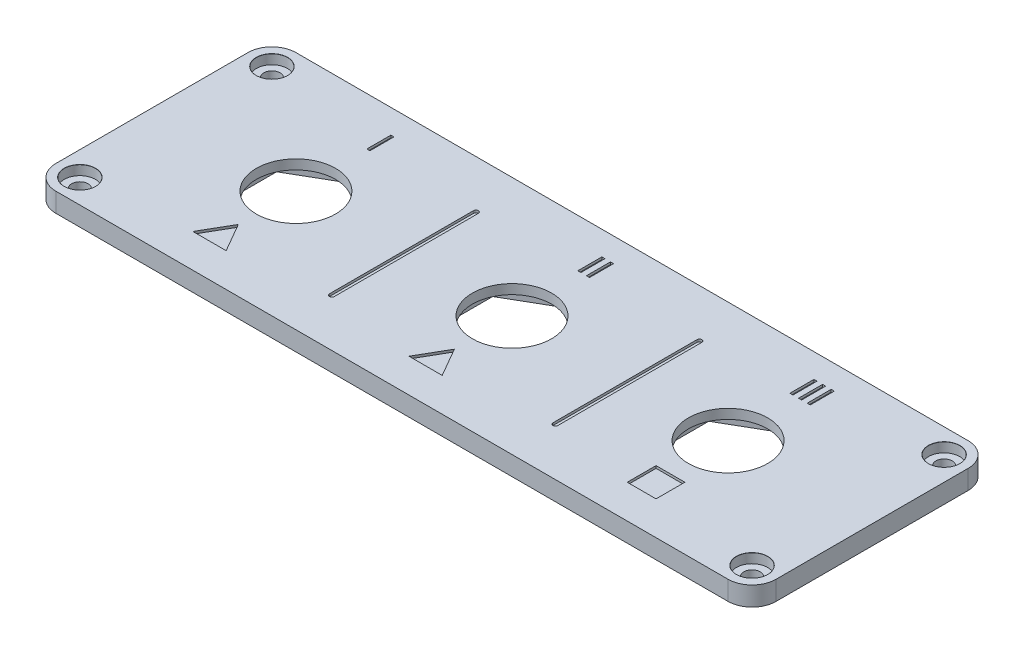
from build123d import *

# Parameters (mm, degrees)
SKETCH1_W                = 150
SKETCH1_H                = 50
BODY_DEPTH               = 4
EDGE_FILLETS_R           = 5
GX16_HOLE_D              = 16.5
GX16_NUT_CUTOUT_DEPTH    = 2
GX16_PATTERN_COUNT       = 3
GX16_PATTERN_PITCH       = 45
DESIGN_CUTOUT_SKETCH_W   = 6
DESIGN_CUTOUT_SKETCH_H   = 6
DESIGN_CUTOUT_SKETCH_W_2 = 0.641025641
DESIGN_CUTOUT_SKETCH_H_2 = 5
DESIGN_CUTOUT_DEPTH      = 0.5


# Read off the part's stored shape, not the designer's step: mounting_holes
with BuildPart() as part:
    # Sketch1 → body (new body)
    with BuildSketch(Plane(origin=(0, 0, 0), x_dir=(1, 0, 0), z_dir=(0, 1, 0))):
        Rectangle(SKETCH1_W, SKETCH1_H)
    extrude(amount=BODY_DEPTH)

    # mounting_holes outline → mounting_holes (revolve, cut)
    with BuildSketch(Plane(origin=(70, 0, 20), x_dir=(1, 0, 0), z_dir=(0, 0, 1))):
        Polygon((0, 0), (1.7, 0), (1.7, 2), (3.25, 2), (3.25, 3.975), (3.275, 4), (0, 4), align=None)
    revolve(axis=Axis((70, 0, 20), (0, 1, 0)), mode=Mode.SUBTRACT)

    # mounting_holes 2 outline → mounting_holes 2 (revolve, cut)
    with BuildSketch(Plane(origin=(-70, 0, -20), x_dir=(1, 0, 0), z_dir=(0, 0, 1))):
        Polygon((0, 4), (0, 0), (1.7, 0), (1.7, 2), (3.25, 2), (3.25, 3.975), (3.275, 4), align=None)
    revolve(axis=Axis((-70, 0, -20), (0, 1, 0)), mode=Mode.SUBTRACT)

    # mounting_holes 3 outline → mounting_holes 3 (revolve, cut)
    with BuildSketch(Plane(origin=(70, 0, -20), x_dir=(1, 0, 0), z_dir=(0, 0, 1))):
        Polygon((0, 4), (0, 0), (1.7, 0), (1.7, 2), (3.25, 2), (3.25, 3.975), (3.275, 4), align=None)
    revolve(axis=Axis((70, 0, -20), (0, 1, 0)), mode=Mode.SUBTRACT)

    # mounting_holes 4 outline → mounting_holes 4 (revolve, cut)
    with BuildSketch(Plane(origin=(-70, 0, 20), x_dir=(1, 0, 0), z_dir=(0, 0, 1))):
        Polygon((0, 4), (0, 0), (1.7, 0), (1.7, 2), (3.25, 2), (3.25, 3.975), (3.275, 4), align=None)
    revolve(axis=Axis((-70, 0, 20), (0, 1, 0)), mode=Mode.SUBTRACT)

    # edge_fillets
    edge_fillets_edges = [part.edges().sort_by_distance(p)[0] for p in [
        (75, 2, 25),
        (-75, 2, 25),
        (-75, 2, -25),
        (75, 2, -25),
    ]]
    fillet(edge_fillets_edges, radius=EDGE_FILLETS_R)

    # gx16_hole (through all)
    with Locations(Plane(origin=(0, 4, 0), x_dir=(1, 0, 0), z_dir=(0, 1, 0))):
        with Locations((-45, 0)):
            gx16_hole = Hole(GX16_HOLE_D / 2)

    # Sketch6 → gx16_nut-cutout (cut)
    with BuildSketch(Plane.XZ):
        Polygon((-45, 10.969655115), (-54.5, 5.484827557), (-54.5, -5.484827557), (-45, -10.969655115), (-35.5, -5.484827557), (-35.5, 5.484827557), align=None)
    gx16_nut_cutout = extrude(amount=-GX16_NUT_CUTOUT_DEPTH, mode=Mode.SUBTRACT)

    # gx16_pattern: gx16_hole, gx16_nut-cutout ×3
    with Locations(*[(i * GX16_PATTERN_PITCH, 0, 0) for i in range(1, GX16_PATTERN_COUNT)]):
        add(gx16_hole, mode=Mode.SUBTRACT)
        add(gx16_nut_cutout, mode=Mode.SUBTRACT)

    # design_cutout_sketch → design_cutout (cut)
    with BuildSketch(Plane(origin=(0, 4, 0), x_dir=(1, 0, 0), z_dir=(0, 1, 0))):
        with BuildLine():
            Line((-22, 15), (-22, -15))
            ThreePointArc((-22, -15), (-22.5, -15.5), (-23, -15))
            Line((-23, -15), (-23, 15))
            ThreePointArc((-23, 15), (-22.5, 15.5), (-22, 15))
        make_face()
        with BuildLine():
            Line((24.543317326, 15), (24.543317326, -15))
            ThreePointArc((24.543317326, -15), (24.043317326, -15.5), (23.543317326, -15))
            Line((23.543317326, -15), (23.543317326, 15))
            ThreePointArc((23.543317326, 15), (24.043317326, 15.5), (24.543317326, 15))
        make_face()
        with Locations((45, -15)):
            Rectangle(DESIGN_CUTOUT_SKETCH_W, DESIGN_CUTOUT_SKETCH_H)
        Polygon((0, -12), (-3.464101615, -18), (3.464101615, -18), align=None)
        Polygon((-45, -12), (-48.464101615, -18), (-41.535898385, -18), align=None)
        with Locations((-44.903846154, 17.5)):
            Rectangle(DESIGN_CUTOUT_SKETCH_W_2, DESIGN_CUTOUT_SKETCH_H_2)
        with Locations((-0.969230769, 17.5)):
            Rectangle(DESIGN_CUTOUT_SKETCH_W_2, DESIGN_CUTOUT_SKETCH_H_2)
        with Locations((0.825641025, 17.5)):
            Rectangle(DESIGN_CUTOUT_SKETCH_W_2, DESIGN_CUTOUT_SKETCH_H_2)
        with Locations((43.211538462, 17.5)):
            Rectangle(DESIGN_CUTOUT_SKETCH_W_2, DESIGN_CUTOUT_SKETCH_H_2)
        with Locations((45.006410257, 17.5)):
            Rectangle(DESIGN_CUTOUT_SKETCH_W_2, DESIGN_CUTOUT_SKETCH_H_2)
        with Locations((46.801282052, 17.5)):
            Rectangle(DESIGN_CUTOUT_SKETCH_W_2, DESIGN_CUTOUT_SKETCH_H_2)
    extrude(amount=-DESIGN_CUTOUT_DEPTH, mode=Mode.SUBTRACT)


solid = part.part
